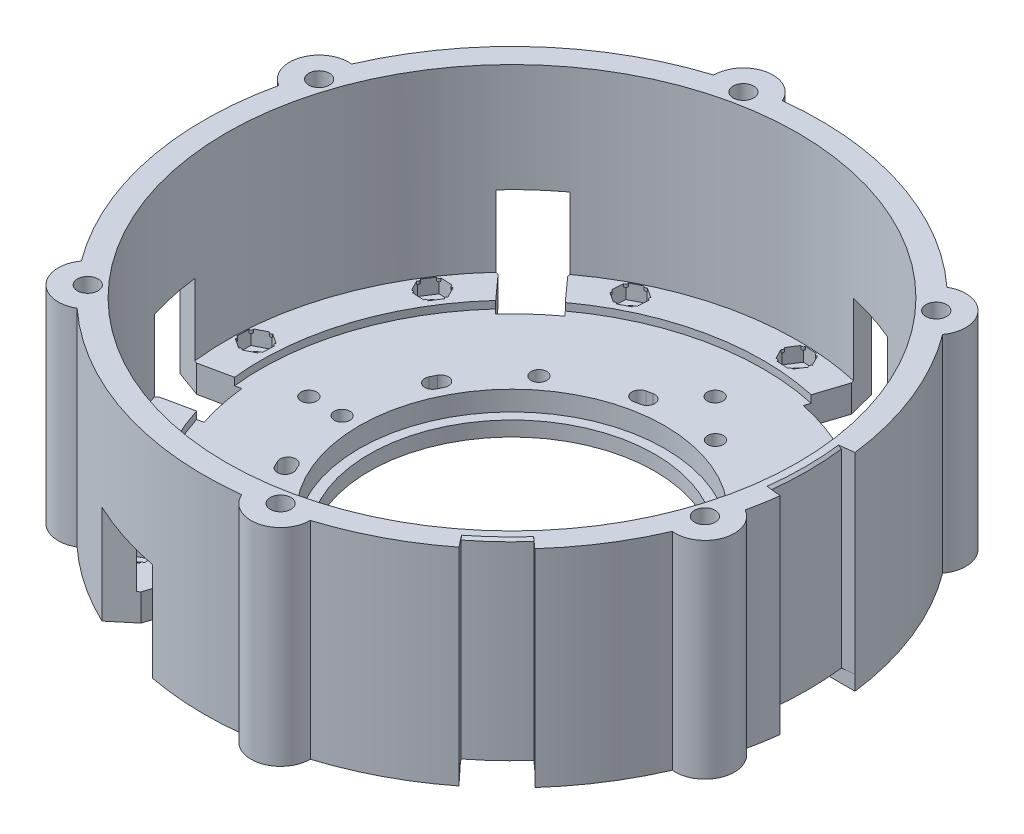
from build123d import *

# Parameters (mm, degrees)
SKETCH14_W               = 12.75
SKETCH14_H               = 3
SKETCH3_R                = 1.6
CUT_EXTRUDE1_DEPTH       = 100.184172124
SKETCH8_R                = 1.6
CUT_EXTRUDE3_DEPTH       = 100.184172124
CIRPATTERN1_COUNT        = 7
CUT_REVOLVE1_ANGLE       = 14
CUT_EXTRUDE12_DEPTH      = 7.61683
CUT_EXTRUDE12_DEPTH_BACK = 7.61683
CUT_REVOLVE2_ANGLE       = 10
CUT_EXTRUDE13_DEPTH      = 5.447234
CUT_EXTRUDE13_DEPTH_BACK = 5.447235
BOSS_EXTRUDE3_DEPTH      = 42
SKETCH13_R               = 2.1
CUT_EXTRUDE4_DEPTH       = 103.151871523
CUT_EXTRUDE9_DEPTH       = 5
SKETCH21_R               = 0.3
BOSS_EXTRUDE2_DEPTH      = 1
CIRPATTERN2_COUNT        = 6
SKETCH16_R               = 1.6
CUT_EXTRUDE6_DEPTH       = 101.866272141
CUT_EXTRUDE11_DEPTH      = 3
SKETCH25_R               = 0.4
BOSS_EXTRUDE4_DEPTH      = 0.6
CIRPATTERN3_COUNT        = 12
SKETCH18_R               = 4.5
SKETCH18_R_2             = 5
CUT_EXTRUDE7_DEPTH       = 4
SKETCH19_R               = 5
CUT_EXTRUDE8_DEPTH       = 2
CUT_EXTRUDE10_DEPTH      = 2
FILLET1_R                = 0.3
CUT_EXTRUDE14_DEPTH      = 101.866272141
CUT_EXTRUDE14_DEPTH_BACK = 20
CHAMFER1_START           = 3
CHAMFER1_DEPTH           = 20


with BuildPart() as part:
    # Sketch9 → Revolve1 (revolve)
    with BuildSketch(Plane.XY, mode=Mode.PRIVATE) as revolve1_sk:
        Polygon((-62.5, 45), (-58, 45), (-58, 8.5), (-51, 8.5), (-51, 7), (-31, 7), (-31, 3), (-29, 3), (-29, 0), (-62.5, 0), align=None)
    revolve(revolve1_sk.sketch.rotate(Axis((0, 0, 0), (0, 1, 0)), 270), axis=Axis((0, 0, 0), (0, 1, 0)))

    # Sketch14 → Cut-Revolve3 (revolve, cut)
    with BuildSketch(Plane.XY, mode=Mode.PRIVATE) as cut_revolve3_sk:
        with Locations((-56.125, 1.5)):
            Rectangle(SKETCH14_W, SKETCH14_H)
    revolve(cut_revolve3_sk.sketch.rotate(Axis((0, 0, 0), (0, 1, 0)), 270), axis=Axis((0, 0, 0), (0, 1, 0)), mode=Mode.SUBTRACT)

    # Sketch3 → Cut-Extrude1 (cut, through all)
    with BuildSketch(Plane(origin=(0, 0, 0), x_dir=(1, 0, 0), z_dir=(0, 1, 0))):
        with Locations(Location((0, 41.25, 0), (0, 0, 90))):
            Circle(SKETCH3_R)
        with Locations(Location((-41.25, 0, 0), (0, 0, 90))):
            Circle(SKETCH3_R)
        with Locations(Location((0, -41.25, 0), (0, 0, 90))):
            Circle(SKETCH3_R)
    extrude(amount=CUT_EXTRUDE1_DEPTH, mode=Mode.SUBTRACT)

    # Sketch8 → Cut-Extrude3 (cut, through all)
    with BuildSketch(Plane.XZ):
        with Locations(Location((-34.5, 0, 0), (0, 0, 270))):
            Circle(SKETCH8_R)
        with BuildLine():
            ThreePointArc((-32.524976131, 15.663202982), (-32.793383004, 15.093178298), (-33.051800695, 14.518556085))
            ThreePointArc((-33.051800695, 14.518556085), (-32.230382652, 12.410174621), (-30.122001188, 13.231592665))
            ThreePointArc((-30.122001188, 13.231592665), (-29.886490328, 13.755278836), (-29.641875754, 14.274775017))
            ThreePointArc((-29.641875754, 14.274775017), (-30.38921196, 16.410539188), (-32.524976131, 15.663202982))
        make_face()
    cut_extrude3 = extrude(amount=-CUT_EXTRUDE3_DEPTH, mode=Mode.SUBTRACT)

    # CirPattern1: Cut-Extrude3 ×7 about axis
    cirpattern1_axis = Axis((0, 0, 0), (0, 1, 0))
    for i in range(1, CIRPATTERN1_COUNT):
        add(cut_extrude3.rotate(cirpattern1_axis, i * 360 / CIRPATTERN1_COUNT), mode=Mode.SUBTRACT)

    # Sketch10 → Cut-Revolve1 (revolve, symmetric, cut)
    with BuildSketch(Plane.XY) as cut_revolve1_sk:
        Polygon((44, 8.5), (44, 7), (48, 3), (62.5, 3), (62.5, 45), (59.5, 45), (60, 44.5), (60, 8.5), (60, 6), (52.5, 6), (50, 8.5), align=None)
    revolve(axis=Axis((0, 0, 0), (0, 1, 0)), revolution_arc=CUT_REVOLVE1_ANGLE / 2, mode=Mode.SUBTRACT)
    revolve(cut_revolve1_sk.sketch, axis=Axis((0, 0, 0), (0, -1, 0)), revolution_arc=CUT_REVOLVE1_ANGLE / 2, mode=Mode.SUBTRACT)

    # Sketch26 → Cut-Extrude12 (cut, two sides: drawn at the far end of the back side and taken through both)
    with BuildSketch(Plane.XY.offset(-CUT_EXTRUDE12_DEPTH_BACK)):
        Polygon((43.672030672, 7), (47.642215279, 3), (62.034134478, 3), (62.034134478, 6), (52.5, 6), (50, 8.5), (43.672030672, 8.5), align=None)
    extrude(amount=CUT_EXTRUDE12_DEPTH + CUT_EXTRUDE12_DEPTH_BACK, mode=Mode.SUBTRACT)

    # Sketch12 → Cut-Revolve2 (revolve, symmetric, cut)
    with BuildSketch(Plane(origin=(0, 0, 0), x_dir=(0.6819983600625024, 0, 0.731353701619167), z_dir=(-0.731353701619167, 0, 0.6819983600625024))) as cut_revolve2_sk:
        Polygon((44, 8.5), (44, 7), (48, 3), (62.5, 3), (62.5, 45), (59.5, 45), (60, 44.5), (60, 8.5), (60, 6), (52.5, 6), (50, 8.5), align=None)
    revolve(axis=Axis((0, 0, 0), (0, 1, 0)), revolution_arc=CUT_REVOLVE2_ANGLE / 2, mode=Mode.SUBTRACT)
    revolve(cut_revolve2_sk.sketch, axis=Axis((0, 0, 0), (0, -1, 0)), revolution_arc=CUT_REVOLVE2_ANGLE / 2, mode=Mode.SUBTRACT)

    # Sketch27 → Cut-Extrude13 (cut, two sides: drawn at the far end of the back side and taken through both)
    with BuildSketch(Plane(origin=(0, 0, 0), x_dir=(0, 1, 0), z_dir=(-0.731353701619167, 0, 0.6819983600625024)).offset(-CUT_EXTRUDE13_DEPTH_BACK)):
        Polygon((8.5, -50), (6, -52.5), (6, -62.5), (3, -62.5), (3, -47.817345508), (7, -43.832566716), (8.5, -43.832566716), align=None)
    extrude(amount=CUT_EXTRUDE13_DEPTH + CUT_EXTRUDE13_DEPTH_BACK, mode=Mode.SUBTRACT)

    # Sketch24 → Boss-Extrude3 (add)
    with BuildSketch(Plane.XZ.offset(-3)):
        with BuildLine():
            ThreePointArc((-39.550839983, 42.423237225), (-49.790703307, 44.831750626), (-46.325026817, 34.899740549))
            ThreePointArc((-46.325026817, 34.899740549), (-43.102399878, 38.809575169), (-39.550839983, 42.423237225))
        make_face()
        with BuildLine():
            ThreePointArc((16.964181157, 55.463650779), (13.930083285, 65.535889249), (7.061548492, 57.568520329))
            ThreePointArc((7.061548492, 57.568520329), (12.058878067, 56.732560843), (16.964181157, 55.463650779))
        make_face()
        with BuildLine():
            ThreePointArc((56.515021139, 13.040413553), (63.720786592, 20.704138623), (53.386575309, 22.66877978))
            ThreePointArc((53.386575309, 22.66877978), (55.161277945, 17.922985674), (56.515021139, 13.040413553))
        make_face()
        with BuildLine():
            ThreePointArc((39.550839983, -42.423237225), (49.790703307, -44.831750626), (46.325026817, -34.899740549))
            ThreePointArc((46.325026817, -34.899740549), (43.102399878, -38.809575169), (39.550839983, -42.423237225))
        make_face()
        with BuildLine():
            ThreePointArc((-16.964181157, -55.463650779), (-13.930083285, -65.535889249), (-7.061548492, -57.568520329))
            ThreePointArc((-7.061548492, -57.568520329), (-12.058878067, -56.732560843), (-16.964181157, -55.463650779))
        make_face()
        with BuildLine():
            ThreePointArc((-56.515021139, -13.040413553), (-63.720786592, -20.704138623), (-53.386575309, -22.66877978))
            ThreePointArc((-53.386575309, -22.66877978), (-55.161277945, -17.922985674), (-56.515021139, -13.040413553))
        make_face()
    extrude(amount=-BOSS_EXTRUDE3_DEPTH)

    # Sketch13 → Cut-Extrude4 (cut, through all)
    with BuildSketch(Plane(origin=(0, 45, 0), x_dir=(1, 0, 0), z_dir=(0, 1, 0))):
        with Locations(Location((-12.68261314, 59.667003645, 0), (0, 0, 270))):
            Circle(SKETCH13_R)
        with Locations(Location((45.331834354, 40.816966988, 0), (0, 0, 270))):
            Circle(SKETCH13_R)
        with Locations(Location((58.014447494, -18.850036657, 0), (0, 0, 270))):
            Circle(SKETCH13_R)
        with Locations(Location((12.68261314, -59.667003645, 0), (0, 0, 270))):
            Circle(SKETCH13_R)
        with Locations(Location((-45.331834354, -40.816966988, 0), (0, 0, 270))):
            Circle(SKETCH13_R)
        with Locations(Location((-58.014447494, 18.850036657, 0), (0, 0, 270))):
            Circle(SKETCH13_R)
    extrude(amount=-CUT_EXTRUDE4_DEPTH, mode=Mode.SUBTRACT)

    # Sketch20 → Cut-Extrude9 (cut)
    with BuildSketch(Plane.XZ.offset(-3)):
        Polygon((-41.37869789, 39.976701893), (-42.627575204, 43.820351043), (-46.580711668, 44.660616138), (-49.284970818, 41.657232083), (-48.036093504, 37.813582933), (-44.08295704, 36.973317838), align=None)
    cut_extrude9 = extrude(amount=-CUT_EXTRUDE9_DEPTH, mode=Mode.SUBTRACT)

    # Sketch21 → Boss-Extrude2 (add)
    with BuildSketch(Plane.XZ.offset(-3)):
        with Locations((-46.580711668, 44.660616138)):
            Circle(SKETCH21_R)
        with Locations((-42.627575204, 43.820351043)):
            Circle(SKETCH21_R)
        with Locations((-41.37869789, 39.976701893)):
            Circle(SKETCH21_R)
        with Locations((-44.08295704, 36.973317838)):
            Circle(SKETCH21_R)
        with Locations((-48.036093504, 37.813582933)):
            Circle(SKETCH21_R)
        with Locations((-49.284970818, 41.657232083)):
            Circle(SKETCH21_R)
    boss_extrude2 = extrude(amount=-BOSS_EXTRUDE2_DEPTH)

    # CirPattern2: Cut-Extrude9, Boss-Extrude2 ×6 about axis
    cirpattern2_axis = Axis((0, 0, 0), (0, 1, 0))
    add([cut_extrude9.rotate(cirpattern2_axis, i * 360 / CIRPATTERN2_COUNT) for i in range(1, CIRPATTERN2_COUNT)], mode=Mode.SUBTRACT)
    add([boss_extrude2.rotate(cirpattern2_axis, i * 360 / CIRPATTERN2_COUNT) for i in range(1, CIRPATTERN2_COUNT)])

    # Sketch16 → Cut-Extrude6 (cut, through all)
    with BuildSketch(Plane.XZ.offset(-3)):
        with Locations(Location((24.969477486, 49.00535883, 0), (0, 0, 270))):
            Circle(SKETCH16_R)
        with Locations(Location((46.126881237, 29.955146926, 0), (0, 0, 270))):
            Circle(SKETCH16_R)
        with Locations(Location((49.00535883, -24.969477486, 0), (0, 0, 270))):
            Circle(SKETCH16_R)
        with Locations(Location((29.955146926, -46.126881237, 0), (0, 0, 270))):
            Circle(SKETCH16_R)
        with Locations(Location((2.878477593, -54.924624412, 0), (0, 0, 270))):
            Circle(SKETCH16_R)
        with Locations(Location((-24.969477486, -49.00535883, 0), (0, 0, 270))):
            Circle(SKETCH16_R)
        with Locations(Location((-46.126881237, -29.955146926, 0), (0, 0, 270))):
            Circle(SKETCH16_R)
        with Locations(Location((-54.924624412, -2.878477593, 0), (0, 0, 270))):
            Circle(SKETCH16_R)
        with Locations(Location((-49.00535883, 24.969477486, 0), (0, 0, 270))):
            Circle(SKETCH16_R)
        with Locations(Location((-29.955146926, 46.126881237, 0), (0, 0, 270))):
            Circle(SKETCH16_R)
        with Locations(Location((-2.878477593, 54.924624412, 0), (0, 0, 270))):
            Circle(SKETCH16_R)
    extrude(amount=-CUT_EXTRUDE6_DEPTH, mode=Mode.SUBTRACT)

    # Sketch23 → Cut-Extrude11 (cut)
    with BuildSketch(Plane(origin=(0, 8.5, 0), x_dir=(1, 0, 0), z_dir=(0, 1, 0))):
        Polygon((6.049552262, 54.75843543), (4.607938807, 57.587761141), (1.436864139, 57.753950123), (-0.292597076, 55.090813393), (1.149016379, 52.261487682), (4.320091048, 52.0952987), align=None)
        Polygon((32.618283656, 44.397420023), (32.784472637, 47.568494692), (30.121335907, 49.297955906), (27.292010196, 47.856342451), (27.125821215, 44.685267782), (29.788957944, 42.955806568), align=None)
        Polygon((50.446972285, 22.140151774), (52.176433499, 24.803288504), (50.734820044, 27.632614216), (47.563745376, 27.798803197), (45.834284161, 25.135666467), (47.275897616, 22.306340756), align=None)
        Polygon((44.397420023, -32.618283656), (47.568494692, -32.784472637), (49.297955906, -30.121335907), (47.856342451, -27.292010196), (44.685267782, -27.125821215), (42.955806568, -29.788957944), align=None)
        Polygon((22.140151774, -50.446972285), (24.803288504, -52.176433499), (27.632614216, -50.734820044), (27.798803197, -47.563745376), (25.135666467, -45.834284161), (22.306340756, -47.275897616), align=None)
        Polygon((-6.049552262, -54.75843543), (-4.607938807, -57.587761141), (-1.436864139, -57.753950123), (0.292597076, -55.090813393), (-1.149016379, -52.261487682), (-4.320091048, -52.0952987), align=None)
        Polygon((-32.618283656, -44.397420023), (-32.784472637, -47.568494692), (-30.121335907, -49.297955906), (-27.292010196, -47.856342451), (-27.125821215, -44.685267782), (-29.788957944, -42.955806568), align=None)
        Polygon((-50.446972285, -22.140151774), (-52.176433499, -24.803288504), (-50.734820044, -27.632614216), (-47.563745376, -27.798803197), (-45.834284161, -25.135666467), (-47.275897616, -22.306340756), align=None)
        Polygon((-54.75843543, 6.049552262), (-57.587761141, 4.607938807), (-57.753950123, 1.436864139), (-55.090813393, -0.292597076), (-52.261487682, 1.149016379), (-52.0952987, 4.320091048), align=None)
        Polygon((-44.397420023, 32.618283656), (-47.568494692, 32.784472637), (-49.297955906, 30.121335907), (-47.856342451, 27.292010196), (-44.685267782, 27.125821215), (-42.955806568, 29.788957944), align=None)
        Polygon((-22.140151774, 50.446972285), (-24.803288504, 52.176433499), (-27.632614216, 50.734820044), (-27.798803197, 47.563745376), (-25.135666467, 45.834284161), (-22.306340756, 47.275897616), align=None)
    extrude(amount=-CUT_EXTRUDE11_DEPTH, mode=Mode.SUBTRACT)

    # Sketch25 → Boss-Extrude4 (add)
    with BuildSketch(Plane(origin=(0, 8.5, 0), x_dir=(1, 0, 0), z_dir=(0, 1, 0))):
        with Locations((1.436864139, 57.753950123)):
            Circle(SKETCH25_R)
        with Locations((-0.292597076, 55.090813393)):
            Circle(SKETCH25_R)
        with Locations((1.149016379, 52.261487682)):
            Circle(SKETCH25_R)
        with Locations((4.320091048, 52.0952987)):
            Circle(SKETCH25_R)
        with Locations((6.049552262, 54.75843543)):
            Circle(SKETCH25_R)
        with Locations((4.607938807, 57.587761141)):
            Circle(SKETCH25_R)
    boss_extrude4 = extrude(amount=-BOSS_EXTRUDE4_DEPTH)

    # CirPattern3: Boss-Extrude4 ×12 about axis, 1 skipped
    cirpattern3_axis = Axis((0, 0, 0), (0, 1, 0))
    add([boss_extrude4.rotate(cirpattern3_axis, i * 360 / CIRPATTERN3_COUNT) for i in range(1, CIRPATTERN3_COUNT) if i not in (9,)])

    # Sketch18 → Cut-Extrude7 (cut)
    with BuildSketch(Plane.XZ):
        with Locations(Location((-41.25, 0, 0), (0, 0, 270))):
            Circle(SKETCH18_R)
        with Locations(Location((0, 41.25, 0), (0, 0, 270))):
            Circle(SKETCH18_R_2)
        with Locations(Location((0, -41.25, 0), (0, 0, 270))):
            Circle(SKETCH18_R_2)
    extrude(amount=-CUT_EXTRUDE7_DEPTH, mode=Mode.SUBTRACT)

    # Sketch19 → Cut-Extrude8 (cut)
    with BuildSketch(Plane.XZ):
        with Locations((-34.5, 0)):
            Circle(SKETCH19_R)
        with Locations(Location((-21.510398164, 26.973186145, 0), (0, 0, 270))):
            Circle(SKETCH19_R)
        with Locations(Location((7.676972221, 33.63501297, 0), (0, 0, 270))):
            Circle(SKETCH19_R)
        with Locations(Location((31.083425943, 14.968989, 0), (0, 0, 270))):
            Circle(SKETCH19_R)
        with Locations(Location((31.083425943, -14.968989, 0), (0, 0, 270))):
            Circle(SKETCH19_R)
        with Locations(Location((7.676972221, -33.63501297, 0), (0, 0, 270))):
            Circle(SKETCH19_R)
        with Locations(Location((-21.510398164, -26.973186145, 0), (0, 0, 270))):
            Circle(SKETCH19_R)
    extrude(amount=-CUT_EXTRUDE8_DEPTH, mode=Mode.SUBTRACT)

    # Sketch22 → Cut-Extrude10 (cut)
    with BuildSketch(Plane.XZ):
        with BuildLine():
            Line((-9.864023636, 37.472908538), (-8.694855216, 37.761320546))
            ThreePointArc((-8.694855216, 37.761320546), (-3.550664646, 34.652895965), (-6.659089227, 29.508705395))
            Line((-6.659089227, 29.508705395), (-7.828257647, 29.220293387))
            ThreePointArc((-7.828257647, 29.220293387), (-12.972448217, 32.328717968), (-9.864023636, 37.472908538))
        make_face()
        with BuildLine():
            Line((23.147381492, 31.075980542), (24.101835666, 30.341709809))
            ThreePointArc((24.101835666, 30.341709809), (24.878921828, 24.381748643), (18.918960662, 23.604662482))
            Line((18.918960662, 23.604662482), (17.964506488, 24.338933215))
            ThreePointArc((17.964506488, 24.338933215), (17.187420326, 30.298894381), (23.147381492, 31.075980542))
        make_face()
        with BuildLine():
            Line((38.728336237, 1.278205364), (38.749352704, 0.074172727))
            ThreePointArc((38.749352704, 0.074172727), (34.574172727, -4.249352704), (30.250647296, -0.074172727))
            Line((30.250647296, -0.074172727), (30.229630828, 1.129859909))
            ThreePointArc((30.229630828, 1.129859909), (34.404810805, 5.453385341), (38.728336237, 1.278205364))
        make_face()
        with BuildLine():
            Line((25.146063881, -29.482084524), (24.217816813, -30.24921793))
            ThreePointArc((24.217816813, -30.24921793), (18.234366379, -29.680604794), (18.802979515, -23.69715436))
            Line((18.802979515, -23.69715436), (19.731226583, -22.930020954))
            ThreePointArc((19.731226583, -22.930020954), (25.714677017, -23.49863409), (25.146063881, -29.482084524))
        make_face()
        with BuildLine():
            Line((-7.371707463, -38.041763441), (-8.550229092, -37.794330515))
            ThreePointArc((-8.550229092, -37.794330515), (-11.836289766, -32.7617561), (-6.803715351, -29.475695425))
            Line((-6.803715351, -29.475695425), (-5.625193723, -29.723128351))
            ThreePointArc((-5.625193723, -29.723128351), (-2.339133048, -34.755702766), (-7.371707463, -38.041763441))
        make_face()
        with BuildLine():
            Line((-34.338432732, -17.955218576), (-34.879778098, -16.879541358))
            ThreePointArc((-34.879778098, -16.879541358), (-32.993978301, -11.172636844), (-27.287073788, -13.058436641))
            Line((-27.287073788, -13.058436641), (-26.745728422, -14.134113859))
            ThreePointArc((-26.745728422, -14.134113859), (-28.631528219, -19.841018372), (-34.338432732, -17.955218576))
        make_face()
        with BuildLine():
            Line((-35.447617777, 15.651972097), (-34.944142778, 16.745886722))
            ThreePointArc((-34.944142778, 16.745886722), (-29.306528221, 18.829705835), (-27.222709107, 13.192091278))
            Line((-27.222709107, 13.192091278), (-27.726184106, 12.098176653))
            ThreePointArc((-27.726184106, 12.098176653), (-33.363798664, 10.014357539), (-35.447617777, 15.651972097))
        make_face()
    extrude(amount=-CUT_EXTRUDE10_DEPTH, mode=Mode.SUBTRACT)

    # Fillet1
    fillet1_edges = [part.edges().sort_by_distance(p)[0] for p in [
        (-38.226851852, 1, -3.333252957),
        (-38.226851852, 1, 3.333252957),
    ]]
    fillet(fillet1_edges, radius=FILLET1_R)

    # Sketch28 → Cut-Extrude14 (cut, two sides: drawn at the far end of the back side and taken through both)
    with BuildSketch(Plane.XZ.offset(-3).offset(-CUT_EXTRUDE14_DEPTH_BACK)):
        with BuildLine():
            Line((-24.006942128, 57.705430677), (-20.051038532, 45.530411307))
            ThreePointArc((-20.051038532, 45.530411307), (-15.37359547, 47.315061686), (-10.540473369, 48.620581251))
            Line((-10.540473369, 48.620581251), (-14.496376965, 60.795600621))
            ThreePointArc((-14.496376965, 60.795600621), (-19.313562148, 59.441032268), (-24.006942128, 57.705430677))
        make_face()
        with BuildLine():
            Line((-61.977839967, 8.062093589), (-49.456012103, 5.400496912))
            ThreePointArc((-49.456012103, 5.400496912), (-48.662843137, 10.343606618), (-47.376895195, 15.181972919))
            Line((-47.376895195, 15.181972919), (-59.898723059, 17.843569596))
            ThreePointArc((-59.898723059, 17.843569596), (-61.134225046, 12.994480676), (-61.977839967, 8.062093589))
        make_face()
        with BuildLine():
            Line((-37.970897839, -49.643337089), (-29.40497357, -40.129914395))
            ThreePointArc((-29.40497357, -40.129914395), (-33.289247666, -36.971455067), (-36.836421825, -33.438608331))
            Line((-36.836421825, -33.438608331), (-45.402346094, -42.952031025))
            ThreePointArc((-45.402346094, -42.952031025), (-41.820662897, -46.446551592), (-37.970897839, -49.643337089))
        make_face()
        with BuildLine():
            Line((24.006942128, -57.705430677), (20.051038532, -45.530411307))
            ThreePointArc((20.051038532, -45.530411307), (15.37359547, -47.315061686), (10.540473369, -48.620581251))
            Line((10.540473369, -48.620581251), (14.496376965, -60.795600621))
            ThreePointArc((14.496376965, -60.795600621), (19.313562148, -59.441032268), (24.006942128, -57.705430677))
        make_face()
    extrude(amount=CUT_EXTRUDE14_DEPTH + CUT_EXTRUDE14_DEPTH_BACK, mode=Mode.SUBTRACT)

    # Chamfer1: read off the stored shape, not the designer's step
    # Chamfer1 outline → Chamfer1 (cut)
    with BuildSketch(Plane(origin=(0, 0, 0), x_dir=(1, 0, 0), z_dir=(0, 1, 0)).offset(CHAMFER1_START)):
        with BuildLine():
            Line((12.930623057, 55.976705596), (14.496376965, 60.795600621))
            ThreePointArc((14.496376965, 60.795600621), (13.03096375, 61.126458949), (11.558021672, 61.422000415))
            Line((11.558021672, 61.422000415), (12.930623057, 55.976705596))
        make_face()
        with BuildLine():
            Line((-37.970897839, 49.643337088), (-34.580489283, 45.877906916))
            Line((-34.580489283, 45.877906916), (-35.541356458, 51.410718543))
            ThreePointArc((-35.541356458, 51.410718543), (-36.766748459, 50.541628463), (-37.970897839, 49.643337088))
        make_face()
        with BuildLine():
            Line((24.006942128, 57.705430677), (22.44118822, 52.886535652))
            Line((22.44118822, 52.886535652), (26.752310056, 56.485076849))
            ThreePointArc((26.752310056, 56.485076849), (25.386959968, 57.111752411), (24.006942128, 57.705430677))
        make_face()
        with BuildLine():
            Line((-42.011937537, 39.186600852), (-45.402346094, 42.952031025))
            ThreePointArc((-45.402346094, 42.952031025), (-46.421584419, 41.848375118), (-47.414001875, 40.720540593))
            Line((-47.414001875, 40.720540593), (-42.011937537, 39.186600852))
        make_face()
        with BuildLine():
            Line((-12.930623057, -55.976705596), (-14.496376965, -60.795600621))
            ThreePointArc((-14.496376965, -60.795600621), (-13.03096375, -61.126458949), (-11.558021672, -61.422000415))
            Line((-11.558021672, -61.422000415), (-12.930623057, -55.976705596))
        make_face()
        with BuildLine():
            Line((-61.977839967, -8.062093589), (-57.021677503, -7.008628736))
            Line((-57.021677503, -7.008628736), (-62.293666514, -5.074358306))
            ThreePointArc((-62.293666514, -5.074358306), (-62.153708428, -6.570123949), (-61.977839967, -8.062093589))
        make_face()
        with BuildLine():
            Line((-24.006942128, -57.705430677), (-22.44118822, -52.886535652))
            Line((-22.44118822, -52.886535652), (-26.752310056, -56.485076849))
            ThreePointArc((-26.752310056, -56.485076849), (-25.386959968, -57.111752411), (-24.006942128, -57.705430677))
        make_face()
        with BuildLine():
            Line((-54.942560595, -16.790104744), (-59.898723059, -17.843569596))
            ThreePointArc((-59.898723059, -17.843569596), (-59.452548169, -19.278083831), (-58.972023547, -20.701459822))
            Line((-58.972023547, -20.701459822), (-54.942560595, -16.790104744))
        make_face()
    extrude(amount=CHAMFER1_DEPTH, mode=Mode.SUBTRACT)


solid = part.part
